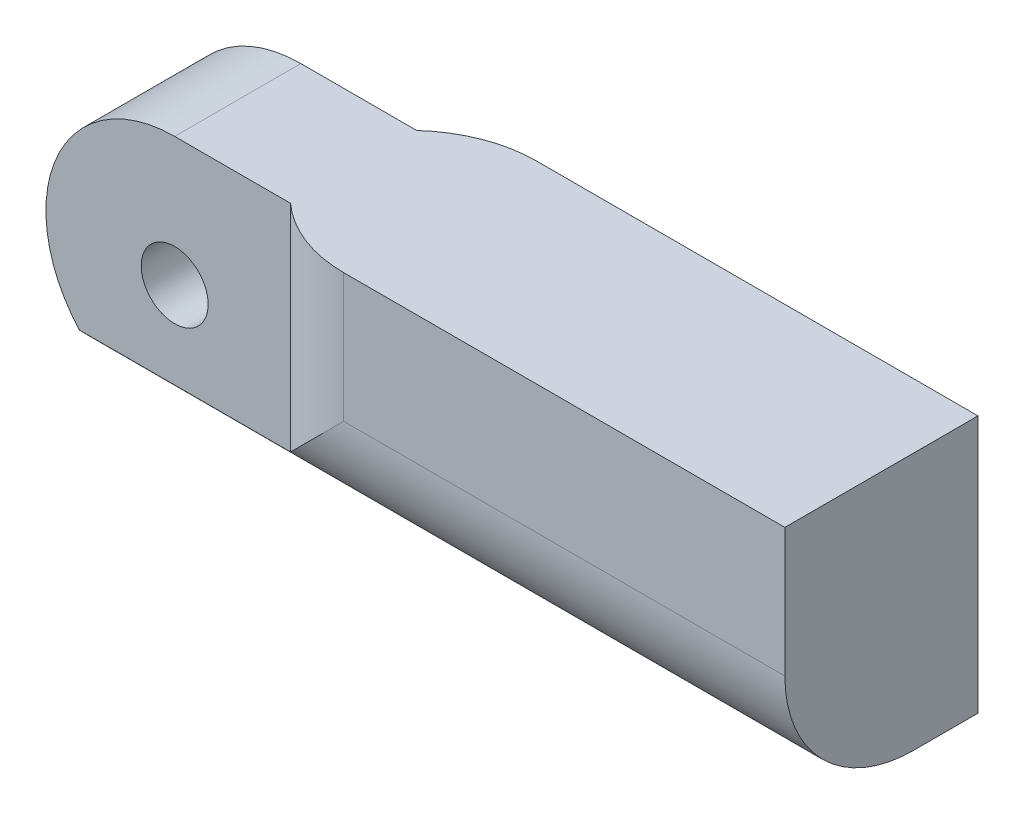
from build123d import *

# Parameters (mm, degrees)
SKETCH1_R           = 2.6
BOSS_EXTRUDE1_DEPTH = 4.9
SKETCH1_3_W         = 41
SKETCH1_3_H         = 20
BOSS_EXTRUDE2_DEPTH = 7.5
FILLET1_R           = 10


with BuildPart() as part:
    # Sketch1 → Boss-Extrude1 (new, symmetric)
    with BuildSketch(Plane.XY):
        with BuildLine():
            Line((9, 10), (0, 10))
            ThreePointArc((0, 10), (-10, 0), (0, -10))
            Line((0, -10), (9, -10))
            Line((9, -10), (9, 10))
        make_face()
        Circle(SKETCH1_R, mode=Mode.SUBTRACT)
    extrude(amount=BOSS_EXTRUDE1_DEPTH, both=True)

    # Sketch1<3> → Boss-Extrude2 (add, symmetric)
    with BuildSketch(Plane.XY):
        with Locations((29.5, 0)):
            Rectangle(SKETCH1_3_W, SKETCH1_3_H)
    extrude(amount=BOSS_EXTRUDE2_DEPTH, both=True)

    # Fillet1
    # the kernel refuses this fillet: 10 mm, written as the material it takes off along each edge
    with BuildSketch(Plane(origin=(-16, -10, 7.5), x_dir=(0, 0, -1), z_dir=(1, 0, 0))) as fillet1_piece_1:
        with BuildLine():
            CenterArc((FILLET1_R, FILLET1_R), FILLET1_R, 180, 90)
            Line((0, FILLET1_R), (-FILLET1_R * 0.02, FILLET1_R))
            Line((-FILLET1_R * 0.02, FILLET1_R), (-FILLET1_R * 0.02, -FILLET1_R * 0.02))
            Line((-FILLET1_R * 0.02, -FILLET1_R * 0.02), (FILLET1_R, -FILLET1_R * 0.02))
            Line((FILLET1_R, -FILLET1_R * 0.02), (FILLET1_R, 0))
        make_face()
    extrude(amount=91, mode=Mode.SUBTRACT)
    with BuildSketch(Plane(origin=(9, 26.815171721, -7.5), x_dir=(1, 0, 0), z_dir=(0, -1, 0))) as fillet1_piece_2:
        with BuildLine():
            CenterArc((6.726068688, 10), FILLET1_R, 227.73141557, 42.26858443)
            Line((0, 2.6), (-0.134521374, 2.452))
            ThreePointArc((-0.134521374, 2.452), (-0.2, 1.3), (-0.2, 0))
            Line((-0.2, 0), (0, -0.2))
            Line((0, -0.2), (6.726068688, -0.2))
            Line((6.726068688, -0.2), (6.726068688, 0))
        make_face()
    extrude(amount=53.630343442, mode=Mode.SUBTRACT)
    with BuildSketch(Plane(origin=(9, 26.815171721, 7.5), x_dir=(1, 0, 0), z_dir=(0, -1, 0))) as fillet1_piece_3:
        with BuildLine():
            CenterArc((6.726068688, -10), FILLET1_R, 90, 42.26858443)
            Line((0, -2.6), (-0.134521374, -2.452))
            ThreePointArc((-0.134521374, -2.452), (-0.2, -1.3), (-0.2, 0))
            Line((-0.2, 0), (0, 0.2))
            Line((0, 0.2), (6.726068688, 0.2))
            Line((6.726068688, 0.2), (6.726068688, 0))
        make_face()
    extrude(amount=53.630343442, mode=Mode.SUBTRACT)


solid = part.part
